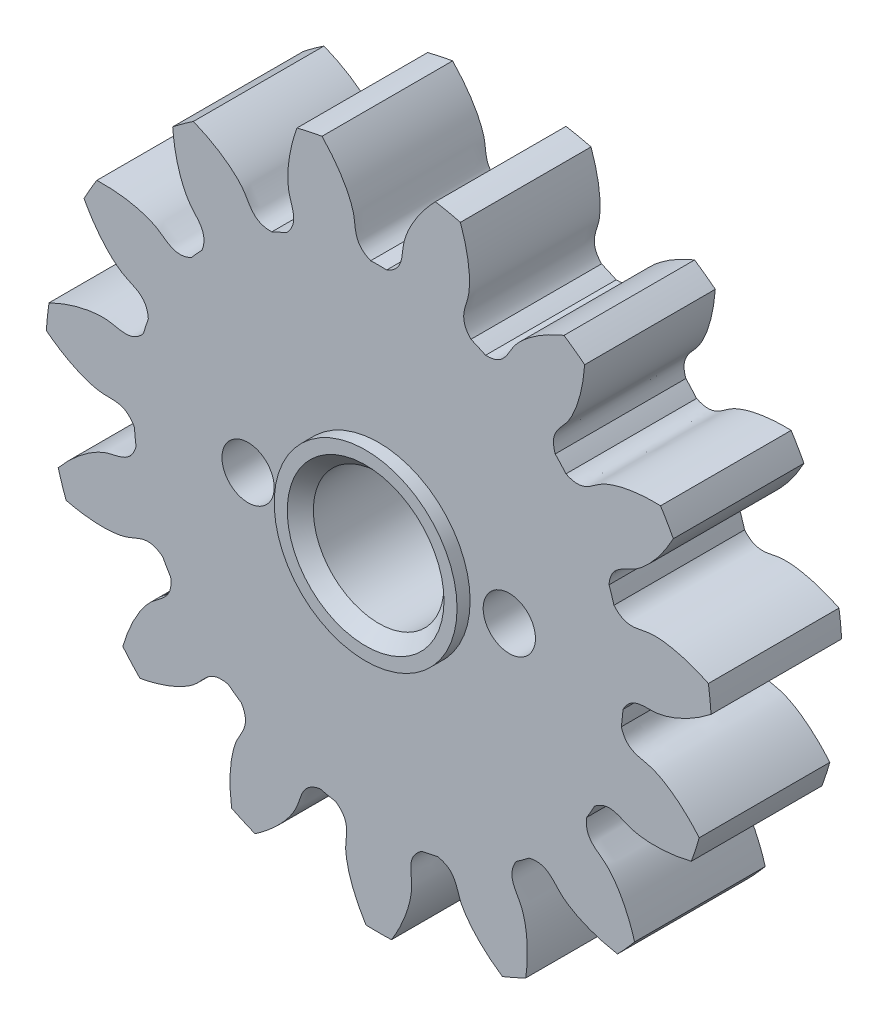
from build123d import *

# Parameters (mm, degrees)
SKETCH_1_R               = 12.75
EXTRUDE_1_DEPTH          = 5
CUT_EXTRUDE_1_DEPTH      = 19.711627401
PATTERN_CIRCULAR_1_COUNT = 15
SKETCH_4_R               = 2.5
CUT_EXTRUDE_2_DEPTH      = 19.69255157
EXTRUDE_START            = 0.5
SKETCH_7_R               = 3.5
SKETCH_7_R_2             = 2.5
EXTRUDE_2_DEPTH          = 0.5
CHAMFER_1_SIZE           = 0.5
MM_TRANSITIONAL_1_D      = 2


with BuildPart() as part:
    # 草图1 → 凸台-拉伸1 (new body)
    with BuildSketch(Plane.XY):
        Circle(SKETCH_1_R)
    extrude(amount=EXTRUDE_1_DEPTH)

    # 草图2 → 切除-拉伸1 (cut, through all)
    with BuildSketch(Plane.XY):
        with BuildLine():
            ThreePointArc((0.306427562, 9.369990776), (0, 9.375), (-0.306427562, 9.369990776))
            add(Edge.make_bspline(
                [(-0.306427562, 9.369990776), (-0.985819588, 9.651615343), (-0.858169701, 10.179494134), (-0.97689073, 10.662755648), (-0.986149768, 10.697487444), (-0.997273271, 10.736090735), (-1.010415356, 10.778503957), (-1.025733602, 10.824659963), (-1.043382046, 10.874487146), (-1.063513204, 10.92790915), (-1.086277288, 10.984845026), (-1.111822276, 11.04520926), (-1.140293737, 11.10891184), (-1.171834724, 11.175858315), (-1.206585651, 11.245949863), (-1.244684177, 11.319083356), (-1.286265091, 11.395151435), (-1.331460195, 11.474042582), (-1.380398197, 11.555641197), (-1.433204596, 11.639827679), (-1.490001574, 11.726478508), (-1.550907895, 11.81546633), (-1.616038794, 11.906660045), (-1.685505881, 11.999924899), (-1.759417036, 12.095122575), (-1.837876316, 12.192111292), (-1.920983857, 12.290745898), (-2.008835785, 12.390877976), (-2.101524119, 12.492355945), (-2.199136692, 12.595025163), (-2.301757059, 12.698728038), (-2.409464417, 12.803304135), (-2.522333527, 12.90859029), (-2.640434633, 13.014420721), (-2.763833392, 13.120627146), (-2.8925908, 13.227038901), (-3.026763122, 13.333483058), (-3.166401833, 13.439784546), (-3.311553545, 13.545766275), (-3.462259959, 13.651249263), (-3.618557797, 13.756052756), (-3.78047876, 13.859994363), (-3.948049464, 13.962890179), (-4.121291414, 14.06455492), (-4.300220913, 14.164802055), (-4.548878493, 14.297653055), (-4.74022787, 14.392550949), (-4.870257583, 14.45389231)],
                knots=[0, 0, 0, 0, 0.202473101, 0.206978902, 0.212085478, 0.217792827, 0.224100949, 0.231009845, 0.238519514, 0.246629958, 0.255341174, 0.264653164, 0.274565928, 0.285079465, 0.296193776, 0.307908861, 0.320224719, 0.33314135, 0.346658755, 0.360776934, 0.375495886, 0.390815612, 0.406736111, 0.423257384, 0.440379431, 0.458102251, 0.476425844, 0.495350211, 0.514875352, 0.535001266, 0.555727954, 0.577055415, 0.59898365, 0.621512658, 0.64464244, 0.668372996, 0.692704325, 0.717636428, 0.743169304, 0.769302954, 0.796037377, 0.823372574, 0.851308544, 0.879845288, 0.908982806, 0.938721097, 1, 1, 1, 1], degree=3))
            ThreePointArc((-4.870257583, 14.45389231), (0, 15.252357583), (4.870257583, 14.45389231))
            add(Edge.make_bspline(
                [(0.306427562, 9.369990776), (0.985819588, 9.651615343), (0.858169701, 10.179494134), (0.97689073, 10.662755648), (0.986149768, 10.697487444), (0.997273271, 10.736090735), (1.010415356, 10.778503957), (1.025733602, 10.824659963), (1.043382046, 10.874487146), (1.063513204, 10.92790915), (1.086277288, 10.984845026), (1.111822276, 11.04520926), (1.140293737, 11.10891184), (1.171834724, 11.175858315), (1.206585651, 11.245949863), (1.244684177, 11.319083356), (1.286265091, 11.395151435), (1.331460195, 11.474042582), (1.380398197, 11.555641197), (1.433204596, 11.639827679), (1.490001574, 11.726478508), (1.550907895, 11.81546633), (1.616038794, 11.906660045), (1.685505881, 11.999924899), (1.759417036, 12.095122575), (1.837876316, 12.192111292), (1.920983857, 12.290745898), (2.008835785, 12.390877976), (2.101524119, 12.492355945), (2.199136692, 12.595025163), (2.301757059, 12.698728038), (2.409464417, 12.803304135), (2.522333527, 12.90859029), (2.640434633, 13.014420721), (2.763833392, 13.120627146), (2.8925908, 13.227038901), (3.026763122, 13.333483058), (3.166401833, 13.439784546), (3.311553545, 13.545766275), (3.462259959, 13.651249263), (3.618557797, 13.756052756), (3.78047876, 13.859994363), (3.948049464, 13.962890179), (4.121291414, 14.06455492), (4.300220913, 14.164802055), (4.548878493, 14.297653055), (4.74022787, 14.392550949), (4.870257583, 14.45389231)],
                knots=[0, 0, 0, 0, 0.202473101, 0.206978902, 0.212085478, 0.217792827, 0.224100949, 0.231009845, 0.238519514, 0.246629958, 0.255341174, 0.264653164, 0.274565928, 0.285079465, 0.296193776, 0.307908861, 0.320224719, 0.33314135, 0.346658755, 0.360776934, 0.375495886, 0.390815612, 0.406736111, 0.423257384, 0.440379431, 0.458102251, 0.476425844, 0.495350211, 0.514875352, 0.535001266, 0.555727954, 0.577055415, 0.59898365, 0.621512658, 0.64464244, 0.668372996, 0.692704325, 0.717636428, 0.743169304, 0.769302954, 0.796037377, 0.823372574, 0.851308544, 0.879845288, 0.908982806, 0.938721097, 1, 1, 1, 1], degree=3))
        make_face()
    cut_extrude_1 = extrude(amount=CUT_EXTRUDE_1_DEPTH, mode=Mode.SUBTRACT)

    # 阵列(圆周)1: 切除-拉伸1 ×15 about axis
    pattern_circular_1_axis = Axis((0, 0, -0.25), (0, 0, 1))
    for i in range(1, PATTERN_CIRCULAR_1_COUNT):
        add(cut_extrude_1.rotate(pattern_circular_1_axis, i * 360 / PATTERN_CIRCULAR_1_COUNT), mode=Mode.SUBTRACT)

    # 草图4 → 切除-拉伸2 (cut, through all)
    with BuildSketch(Plane.XY.offset(5)):
        Circle(SKETCH_4_R)
    extrude(amount=-CUT_EXTRUDE_2_DEPTH, mode=Mode.SUBTRACT)

    # 草图7 → 凸台-拉伸2 (add)
    with BuildSketch(Plane.XY.offset(5).offset(EXTRUDE_START)):
        Circle(SKETCH_7_R)
        Circle(SKETCH_7_R_2, mode=Mode.SUBTRACT)
    extrude(amount=-EXTRUDE_2_DEPTH)

    # 倒角1
    chamfer_1_edges = [part.edges().sort_by_distance(p)[0] for p in [
        (-2.5, 0, 0),
        (-2.5, 0, 5.5),
    ]]
    chamfer(chamfer_1_edges, length=CHAMFER_1_SIZE)

    # 大小mm Transitional 暗销孔1 (through all)
    with Locations(Plane.XY.offset(5)):
        with Locations((5, 0), (-5, 0)):
            Hole(MM_TRANSITIONAL_1_D / 2)


solid = part.part
